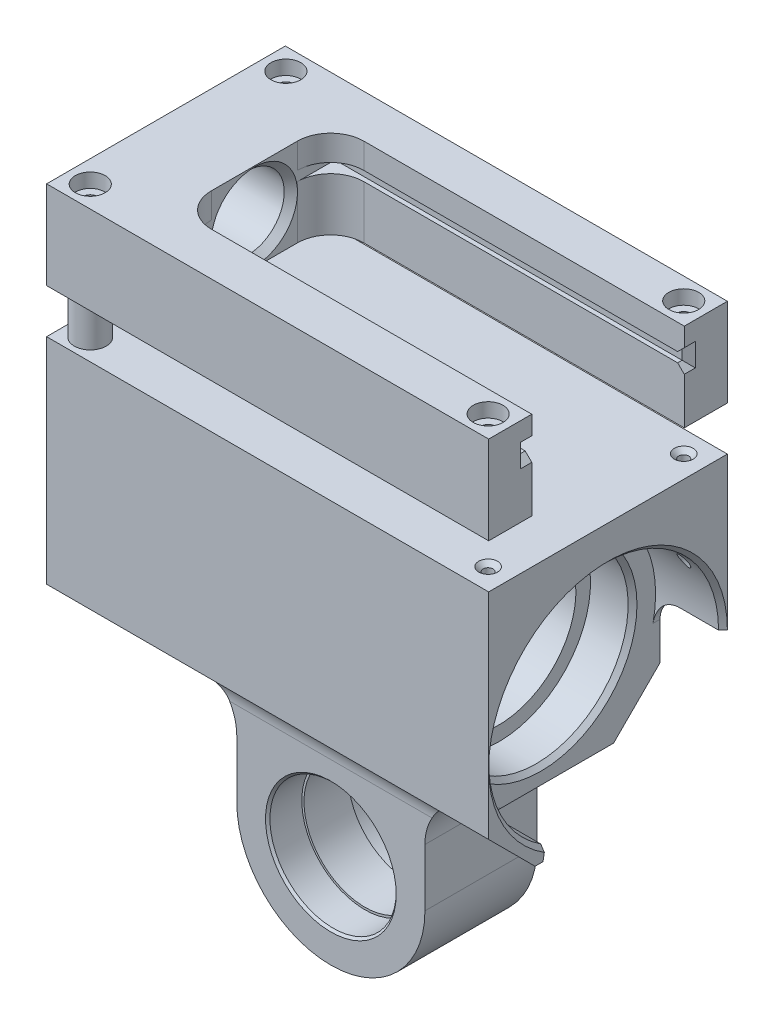
from build123d import *
from OCP.BRepFilletAPI import BRepFilletAPI_MakeFillet

# Parameters (mm, degrees)
SKETCH2_R                                   = 14.28
BOSS_EXTRUDE1_DEPTH                         = 12.7
SKETCH4_W                                   = 100
SKETCH4_H                                   = 59
BOSS_EXTRUDE2_DEPTH                         = 27
SKETCH3_R                                   = 17.5
CUT_EXTRUDE1_DEPTH                          = 134.360413917
SKETCH5_R                                   = 14.28
SKETCH5_R_2                                 = 13.78
BOSS_EXTRUDE3_DEPTH                         = 5
FILLET1_R1                                  = 12
FILLET1_R2                                  = 6
CUT_EXTRUDE2_DEPTH                          = 15.24
SKETCH7_W                                   = 54
SKETCH7_H                                   = 19.938
BOSS_EXTRUDE6_DEPTH                         = 20
BOSS_EXTRUDE7_DEPTH                         = 80
CBORE_FOR_4_BINDING_HEAD_MACHINE_SC_2_COUNT = 2
CBORE_FOR_4_BINDING_HEAD_MACHINE_SC_2_PITCH = 44.25
CBORE_FOR_4_BINDING_HEAD_MACHINE_SC_3_COUNT = 2
CBORE_FOR_4_BINDING_HEAD_MACHINE_SC_3_PITCH = 100.289892312
CBORE_FOR_4_BINDING_HEAD_MACHINE_SC_4_COUNT = 2
CBORE_FOR_4_BINDING_HEAD_MACHINE_SC_4_PITCH = 90
F_4_40_START                                = 60
F_4_40_TAPPED_HOLE1_OUTLINE_R               = 1.1303
F_4_40_TAPPED_HOLE1_DEPTH                   = 25
FILLET2_R                                   = 7.5
SKETCH15_R                                  = 20.7883
CUT_EXTRUDE3_DEPTH                          = 9.525
CHAMFER1_SIZE                               = 1
CUT_EXTRUDE4_START                          = -1.6
SKETCH16_R                                  = 8.25
CUT_EXTRUDE4_DEPTH                          = 153.383336319
SKETCH17_R                                  = 9.165522347
SKETCH17_R_2                                = 3.75
BOSS_EXTRUDE8_DEPTH                         = 1.6
SKETCH18_R                                  = 1
CUT_EXTRUDE5_DEPTH                          = 154.983336319
CHAMFER5_SIZE                               = 1.5
CHAMFER6_SIZE                               = 1.5
FILLET3_R                                   = 5.5
CHAMFER7_SIZE                               = 5.992013882
CHAMFER7_SIZE_2                             = 6
FILLET4_R                                   = 5.5
CHAMFER8_SIZE                               = 1
CHAMFER10_SIZE                              = 1
CHAMFER11_SIZE                              = 0.5
SKETCH19_R                                  = 3.6
SKETCH19_R_2                                = 1.6
BOSS_EXTRUDE9_DEPTH                         = 10


with BuildPart() as part:
    # Sketch2 → Boss-Extrude1 (new, symmetric)
    with BuildSketch(Plane.XY):
        with BuildLine():
            Line((-21.28, 0), (-21.28, 82.28))
            Line((-21.28, 82.28), (21.28, 82.28))
            Line((21.28, 82.28), (21.28, 0))
            ThreePointArc((21.28, 0), (0, -21.28), (-21.28, 0))
        make_face()
        Circle(SKETCH2_R, mode=Mode.SUBTRACT)
    extrude(amount=BOSS_EXTRUDE1_DEPTH, both=True)

    # Sketch4 → Boss-Extrude2 (add, symmetric)
    with BuildSketch(Plane.XY):
        with Locations((0, 54.5)):
            Rectangle(SKETCH4_W, SKETCH4_H)
    extrude(amount=BOSS_EXTRUDE2_DEPTH, both=True)

    # Sketch3 → Cut-Extrude1 (cut, through all)
    with BuildSketch(Plane(origin=(50, 0, 0), x_dir=(0, 0, -1), z_dir=(1, 0, 0))):
        with Locations((0, 49.5)):
            Circle(SKETCH3_R)
    extrude(amount=-CUT_EXTRUDE1_DEPTH, mode=Mode.SUBTRACT)

    # Sketch5 → Boss-Extrude3 (add, symmetric)
    with BuildSketch(Plane.XY):
        Circle(SKETCH5_R)
        Circle(SKETCH5_R_2, mode=Mode.SUBTRACT)
    extrude(amount=BOSS_EXTRUDE3_DEPTH, both=True)

    # Fillet1: one fillet with a radius per group of edges: ONE call of the kernel's fillet builder (fillet() takes one radius for all edges)
    fillet1_edges_1 = [part.edges().sort_by_distance(p)[0] for p in [
        (-21.28, 25, 0),
        (21.28, 25, 0),
    ]]
    fillet1_edges_2 = [part.edges().sort_by_distance(p)[0] for p in [
        (0, 25, 12.7),
        (0, 25, -12.7),
    ]]
    fillet1 = BRepFilletAPI_MakeFillet(part.part.solid().wrapped)
    for e in fillet1_edges_1:
        fillet1.Add(FILLET1_R1, e.wrapped)
    for e in fillet1_edges_2:
        fillet1.Add(FILLET1_R2, e.wrapped)
    add(Compound.cast(fillet1.Shape()), mode=Mode.REPLACE)

    # Sketch6 → Cut-Extrude2 (cut)
    with BuildSketch(Plane.ZY.offset(50)):
        with BuildLine():
            Line((0, 23.5), (0, -0.612195027))
            Line((0, -0.612195027), (-26, -0.612195027))
            Line((-26, -0.612195027), (-31.032905967, -0.612195027))
            Line((-31.032905967, -0.612195027), (-31.032905967, 49.5))
            Line((-31.032905967, 49.5), (-26, 49.5))
            ThreePointArc((-26, 49.5), (18.384776311, 67.884776311), (0, 23.5))
        make_face()
    cut_extrude2 = extrude(amount=-CUT_EXTRUDE2_DEPTH, mode=Mode.SUBTRACT)

    # Mirror1: Cut-Extrude2 across plane
    add(cut_extrude2.mirror(Plane(origin=(0, 0, 0), x_dir=(0, 0, 1), z_dir=(1, 0, 0))), mode=Mode.SUBTRACT)

    # #4-40 Tapped Hole1: read off the stored shape, not the designer's step
    # #4-40 Tapped Hole1 outline → #4-40 Tapped Hole1 (cut)
    with BuildSketch(Plane(origin=(0, 0, 0), x_dir=(1, 0, 0), z_dir=(0, 1, 0)).offset(F_4_40_START)):
        with Locations((45, -22.125)):
            Circle(F_4_40_TAPPED_HOLE1_OUTLINE_R)
        with Locations((45, 22.125)):
            Circle(F_4_40_TAPPED_HOLE1_OUTLINE_R)
        with Locations((-45, -22.125)):
            Circle(F_4_40_TAPPED_HOLE1_OUTLINE_R)
        with Locations((-45, 22.125)):
            Circle(F_4_40_TAPPED_HOLE1_OUTLINE_R)
    extrude(amount=F_4_40_TAPPED_HOLE1_DEPTH, mode=Mode.SUBTRACT)

    # Sketch15 → Cut-Extrude3 (cut)
    with BuildSketch(Plane(origin=(34.76, 0, 0), x_dir=(0, 0, -1), z_dir=(1, 0, 0))):
        with Locations(Location((0, 49.5, 0), (0, 0, 90))):
            Circle(SKETCH15_R)
    cut_extrude3 = extrude(amount=-CUT_EXTRUDE3_DEPTH, mode=Mode.SUBTRACT)

    # Mirror2: Cut-Extrude3 across plane
    add(cut_extrude3.mirror(Plane(origin=(0, 0, 0), x_dir=(0, 0, 1), z_dir=(1, 0, 0))), mode=Mode.SUBTRACT)

    # Chamfer1
    chamfer1_edges = [part.edges().sort_by_distance(p)[0] for p in [
        (34.76, 28.7117, 0),
        (-34.76, 28.7117, 0),
    ]]
    chamfer(chamfer1_edges, length=CHAMFER1_SIZE)

    # Chamfer3
    # the kernel refuses this chamfer: 10.5 mm, written as the material it takes off along each edge
    with BuildSketch(Plane(origin=(82.302052332, 25, 27), x_dir=(0, 0, -1), z_dir=(-1, 0, 0))) as chamfer3_piece_1:
        with BuildLine():
            Line((12.727386361, 2.227386361), (-2.227386361, -12.727386361))
            Line((-2.227386361, -12.727386361), (-3.802386361, -12.727386361))
            ThreePointArc((-3.802386361, -12.727386361), (-1.575, -6.36369318), (-1.575, 0))
            Line((-1.575, 0), (0, 1.575))
            ThreePointArc((0, 1.575), (6.36369318, 1.575), (12.727386361, 3.802386361))
            Line((12.727386361, 3.802386361), (12.727386361, 2.227386361))
        make_face()
    extrude(amount=164.604104664, mode=Mode.SUBTRACT)
    with BuildSketch(Plane(origin=(67.062052332, 25, -27), x_dir=(0, 0, 1), z_dir=(-1, 0, 0))) as chamfer3_piece_2:
        with BuildLine():
            Line((12.727386361, -2.227386361), (-2.227386361, 12.727386361))
            Line((-2.227386361, 12.727386361), (-3.802386361, 12.727386361))
            ThreePointArc((-3.802386361, 12.727386361), (-1.575, 6.36369318), (-1.575, 0))
            Line((-1.575, 0), (0, -1.575))
            ThreePointArc((0, -1.575), (6.36369318, -1.575), (12.727386361, -3.802386361))
            Line((12.727386361, -3.802386361), (12.727386361, -2.227386361))
        make_face()
    extrude(amount=134.124104664, mode=Mode.SUBTRACT)

    # Fillet3
    fillet3_edges = [part.edges().sort_by_distance(p)[0] for p in [
        (-34.76, 49.5, -26.5),
        (34.76, 49.5, -26.5),
    ]]
    fillet(fillet3_edges, radius=FILLET3_R)

    # Chamfer7
    # the kernel refuses this chamfer: 6, 5.992013882 mm, written as the material it takes off along each edge
    with BuildSketch(Plane(origin=(-34.76, 25, 8.703447593), x_dir=(0, 0, 1), z_dir=(-1, 0, 0))) as chamfer7_piece_1:
        with BuildLine():
            Line((CHAMFER7_SIZE, 0), (5.530305418, 2.742236438))
            ThreePointArc((5.530305418, 2.742236438), (2.878279334, 1.222036142), (0, 0))
            Line((0, 0), (CHAMFER7_SIZE, 0))
        make_face()
    extrude(amount=30.856297971, mode=Mode.SUBTRACT)
    with BuildSketch(Plane(origin=(34.76, 25, 8.703447593), x_dir=(0, 0, 1), z_dir=(1, 0, 0))) as chamfer7_piece_2:
        with BuildLine():
            Line((CHAMFER7_SIZE_2, 0), (5.517899842, -2.734125859))
            ThreePointArc((5.517899842, -2.734125859), (2.870808424, -1.218320557), (0, 0))
            Line((0, 0), (CHAMFER7_SIZE_2, 0))
        make_face()
    extrude(amount=30.81497635, mode=Mode.SUBTRACT)

    # Fillet4
    fillet4_edges = [part.edges().sort_by_distance(p)[0] for p in [
        (-34.76, 26.371118219, 14.464607243),
        (34.76, 26.367062929, 14.462397514),
    ]]
    fillet(fillet4_edges, radius=FILLET4_R)

    # Chamfer8
    chamfer8_edges = [part.edges().sort_by_distance(p)[0] for p in [
        (50, 72.366515184, 12.374266982),
        (-50, 72.370041302, 12.367748819),
    ]]
    chamfer(chamfer8_edges, length=CHAMFER8_SIZE - 0.0001)  # a hair under: the kernel refuses the full size

    # Chamfer10
    chamfer10_edges = [part.edges().sort_by_distance(p)[0] for p in [
        (43.8697, 84, 22.125),
        (43.8697, 84, -22.125),
        (-46.1303, 84, 22.125),
        (-46.1303, 84, -22.125),
    ]]
    chamfer(chamfer10_edges, length=CHAMFER10_SIZE)

    # Chamfer11
    chamfer11_edges = [part.edges().sort_by_distance(p)[0] for p in [
        (-14.28, 0, -12.7),
        (-14.28, 0, 12.7),
    ]]
    chamfer(chamfer11_edges, length=CHAMFER11_SIZE)


with BuildPart() as body_2:
    # Sketch7 → Boss-Extrude6 (new body)
    with BuildSketch(Plane.ZY.offset(50)):
        with Locations((0, 103.969)):
            Rectangle(SKETCH7_W, SKETCH7_H)
        with BuildLine():
            Line((4.938324412, 109.938), (-4.938324412, 109.938))
            ThreePointArc((-4.938324412, 109.938), (-7.747, 103.969), (-4.938324412, 98))
            Line((-4.938324412, 98), (4.938324412, 98))
            ThreePointArc((4.938324412, 98), (7.747, 103.969), (4.938324412, 109.938))
        make_face(mode=Mode.SUBTRACT)
    extrude(amount=-BOSS_EXTRUDE6_DEPTH)

    # Sketch8 → Boss-Extrude7 (add)
    with BuildSketch(Plane(origin=(-30, 0, 0), x_dir=(0, 0, -1), z_dir=(1, 0, 0))):
        Polygon((27, 94), (27, 113.938), (17.25, 113.938), (17.25, 108.2), (18.25, 108.2), (18.25, 106), (17.25, 106), (17.25, 94), align=None)
        Polygon((-17.25, 94), (-27, 94), (-27, 113.938), (-17.25, 113.938), (-17.25, 108.2), (-18.25, 108.2), (-18.25, 106), (-17.25, 106), align=None)
    extrude(amount=BOSS_EXTRUDE7_DEPTH)

    # Sketch11 → CBORE for #4 Binding Head Machine Screw1 (revolve, cut)
    with BuildSketch(Plane(origin=(-45, 113.938, -22.125), x_dir=(0, 0, 1), z_dir=(1, 0, 0))):
        Polygon((0, 0), (0, 30.917574487), (1.63195, 29.937), (1.63195, 3.227197), (3.37312, 3.227197), (3.37312, 0), align=None)
    cbore_for_4_binding_head_machine_screw1 = revolve(axis=Axis((-45, 120.288, -22.125), (0, -1, 0)), mode=Mode.SUBTRACT)

    # CBORE for _4 Binding Head Machine Sc 2: CBORE for #4 Binding Head Machine Screw1 ×2
    with Locations(*[(0, 0, i * CBORE_FOR_4_BINDING_HEAD_MACHINE_SC_2_PITCH) for i in range(1, CBORE_FOR_4_BINDING_HEAD_MACHINE_SC_2_COUNT)]):
        add(cbore_for_4_binding_head_machine_screw1, mode=Mode.SUBTRACT)

    # CBORE for _4 Binding Head Machine Sc 3: CBORE for #4 Binding Head Machine Screw1 ×2
    with Locations(*[Vector(0.8973985107073343, 0, 0.44122093443110605) * (i * CBORE_FOR_4_BINDING_HEAD_MACHINE_SC_3_PITCH) for i in range(1, CBORE_FOR_4_BINDING_HEAD_MACHINE_SC_3_COUNT)]):
        add(cbore_for_4_binding_head_machine_screw1, mode=Mode.SUBTRACT)

    # CBORE for _4 Binding Head Machine Sc 4: CBORE for #4 Binding Head Machine Screw1 ×2
    with Locations(*[(i * CBORE_FOR_4_BINDING_HEAD_MACHINE_SC_4_PITCH, 0, 0) for i in range(1, CBORE_FOR_4_BINDING_HEAD_MACHINE_SC_4_COUNT)]):
        add(cbore_for_4_binding_head_machine_screw1, mode=Mode.SUBTRACT)

    # Fillet2
    fillet2_edges = [body_2.edges().sort_by_distance(p)[0] for p in [
        (-30, 100, -17.25),
        (-30, 100, 17.25),
        (-30, 111.069, 17.25),
        (-30, 111.069, -17.25),
    ]]
    fillet(fillet2_edges, radius=FILLET2_R)

    # Sketch16 → Cut-Extrude4 (cut, through all)
    with BuildSketch(Plane.ZY.offset(50).offset(CUT_EXTRUDE4_START)):
        with Locations((0, 103.969)):
            Circle(SKETCH16_R)
    extrude(amount=-CUT_EXTRUDE4_DEPTH, mode=Mode.SUBTRACT)

    # Sketch17 → Boss-Extrude8 (add)
    with BuildSketch(Plane.ZY.offset(50)):
        with Locations((0, 103.969)):
            Circle(SKETCH17_R)
        with Locations((0, 103.969)):
            Circle(SKETCH17_R_2, mode=Mode.SUBTRACT)
    extrude(amount=-BOSS_EXTRUDE8_DEPTH)

    # Sketch18 → Cut-Extrude5 (cut, through all)
    with BuildSketch(Plane.ZY.offset(50)):
        with Locations((5.5, 103.969)):
            Circle(SKETCH18_R)
        with Locations((-5.5, 103.969)):
            Circle(SKETCH18_R)
    extrude(amount=-CUT_EXTRUDE5_DEPTH, mode=Mode.SUBTRACT)

    # Chamfer5
    chamfer5_edges = [body_2.edges().sort_by_distance(p)[0] for p in [
        (50, 106, -17.75),
        (50, 107.1, -18.25),
        (50, 108.2, -17.75),
        (50, 108.2, 17.75),
        (50, 107.1, 18.25),
        (50, 106, 17.75),
    ]]
    chamfer(chamfer5_edges, length=CHAMFER5_SIZE)

    # Chamfer6
    chamfer6_edges = [body_2.edges().sort_by_distance(p)[0] for p in [
        (-30, 103.969, -8.25),
    ]]
    chamfer(chamfer6_edges, length=CHAMFER6_SIZE - 0.0001)  # a hair under: the kernel refuses the full size


with BuildPart() as body_3:
    # Sketch19 → Boss-Extrude9 (new body)
    with BuildSketch(Plane(origin=(0, 84, 0), x_dir=(1, 0, 0), z_dir=(0, 1, 0))):
        with Locations(Location((-45, -22.125, 0), (0, 0, 90))):
            Circle(SKETCH19_R)
        with Locations(Location((-45, -22.125, 0), (0, 0, 90))):
            Circle(SKETCH19_R_2, mode=Mode.SUBTRACT)
    extrude(amount=BOSS_EXTRUDE9_DEPTH)


solid = Compound([part.part, body_2.part, body_3.part])
